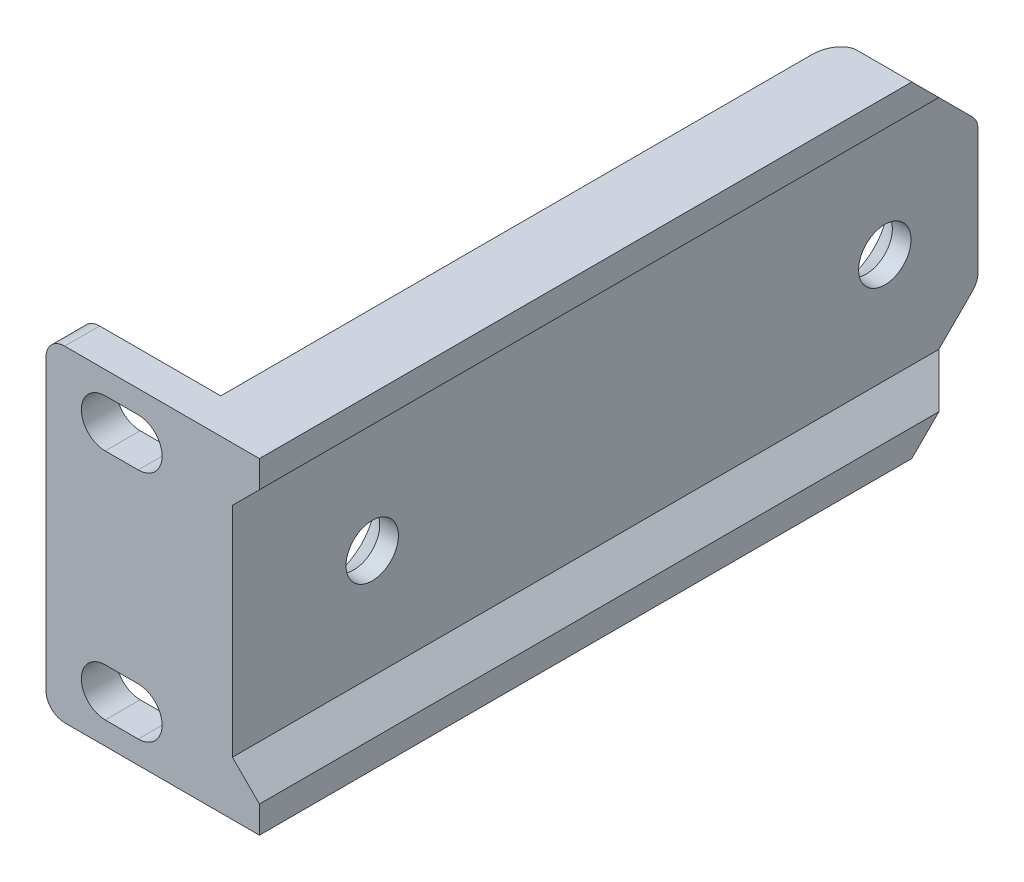
from build123d import *

# Parameters (mm, degrees)
BOSS_EXTRUDE1_DEPTH                              = 22.225
SKETCH2_W                                        = 3.683
SKETCH2_H                                        = 3.683
BOSS_EXTRUDE2_DEPTH                              = 101.6
CUT_EXTRUDE1_DEPTH                               = 108.059192156
FILLET1_R                                        = 2.54
CSK_FOR_1_4_FLAT_HEAD_MACHINE_SCREW1_D           = 7.14248
CSK_FOR_1_4_FLAT_HEAD_MACHINE_SCREW1_CSINK_D     = 13.7609834
CSK_FOR_1_4_FLAT_HEAD_MACHINE_SCREW1_CSINK_ANGLE = 82
CUT_EXTRUDE2_DEPTH                               = 106.732743864
FILLET2_R                                        = 2.54
CHAMFER1_SIZE                                    = 3.683


with BuildPart() as part:
    # Sketch1 → Boss-Extrude1 (new, symmetric)
    with BuildSketch(Plane(origin=(0, 0, 0), x_dir=(1, 0, 0), z_dir=(0, 1, 0))):
        Polygon((0, 0), (0, 101.6), (-6.35, 101.6), (-6.35, 4.7625), (-25.4, 4.7625), (-25.4, 0), align=None)
    extrude(amount=BOSS_EXTRUDE1_DEPTH, both=True)

    # Sketch2 → Boss-Extrude2 (add)
    with BuildSketch(Plane.XY):
        with Locations((1.8415, 20.3835)):
            Rectangle(SKETCH2_W, SKETCH2_H)
        with Locations((1.8415, -20.3835)):
            Rectangle(SKETCH2_W, SKETCH2_H)
    extrude(amount=-BOSS_EXTRUDE2_DEPTH)

    # Sketch3 → Cut-Extrude1 (cut, through all)
    with BuildSketch(Plane.XY):
        with BuildLine():
            Line((-17.33005, 19.1262), (-12.83245, 19.1262))
            ThreePointArc((-12.83245, 19.1262), (-9.58125, 15.875), (-12.83245, 12.6238))
            Line((-12.83245, 12.6238), (-17.33005, 12.6238))
            ThreePointArc((-17.33005, 12.6238), (-20.58125, 15.875), (-17.33005, 19.1262))
        make_face()
        with BuildLine():
            Line((-17.33005, -19.1262), (-12.83245, -19.1262))
            ThreePointArc((-12.83245, -19.1262), (-9.58125, -15.875), (-12.83245, -12.6238))
            Line((-12.83245, -12.6238), (-17.33005, -12.6238))
            ThreePointArc((-17.33005, -12.6238), (-20.58125, -15.875), (-17.33005, -19.1262))
        make_face()
    extrude(amount=-CUT_EXTRUDE1_DEPTH, mode=Mode.SUBTRACT)

    # Fillet1
    fillet1_edges = [part.edges().sort_by_distance(p)[0] for p in [
        (-25.4, 22.225, -2.38125),
        (-25.4, -22.225, -2.38125),
    ]]
    fillet(fillet1_edges, radius=FILLET1_R)

    # CSK for 1/4 Flat Head Machine Screw1 (through all)
    with Locations(Plane.ZY.offset(6.35)):
        with Locations((-19.05, 0), (-88.9, 0)):
            CounterSinkHole(CSK_FOR_1_4_FLAT_HEAD_MACHINE_SCREW1_D / 2, CSK_FOR_1_4_FLAT_HEAD_MACHINE_SCREW1_CSINK_D / 2, counter_sink_angle=CSK_FOR_1_4_FLAT_HEAD_MACHINE_SCREW1_CSINK_ANGLE)

    # Sketch6 → Cut-Extrude2 (cut, through all)
    with BuildSketch(Plane.ZY.offset(6.35)):
        Polygon((-101.6, 22.225), (-88.9, 22.225), (-101.6, 9.525), align=None)
        Polygon((-88.9, -22.225), (-101.6, -9.525), (-101.6, -22.225), align=None)
    extrude(amount=-CUT_EXTRUDE2_DEPTH, mode=Mode.SUBTRACT)

    # Fillet2
    fillet2_edges = [part.edges().sort_by_distance(p)[0] for p in [
        (-6.35, 0, -101.6),
        (-3.175, 9.525, -101.6),
        (-6.35, 15.875, -95.25),
        (-3.175, -9.525, -101.6),
        (-6.35, -15.875, -95.25),
    ]]
    fillet(fillet2_edges, radius=FILLET2_R)

    # Chamfer1
    chamfer1_edges = [part.edges().sort_by_distance(p)[0] for p in [
        (0, -18.542, -46.2915),
        (0, 18.542, -46.2915),
    ]]
    chamfer(chamfer1_edges, length=CHAMFER1_SIZE - 0.0001)  # a hair under: the kernel refuses the full size


solid = part.part
